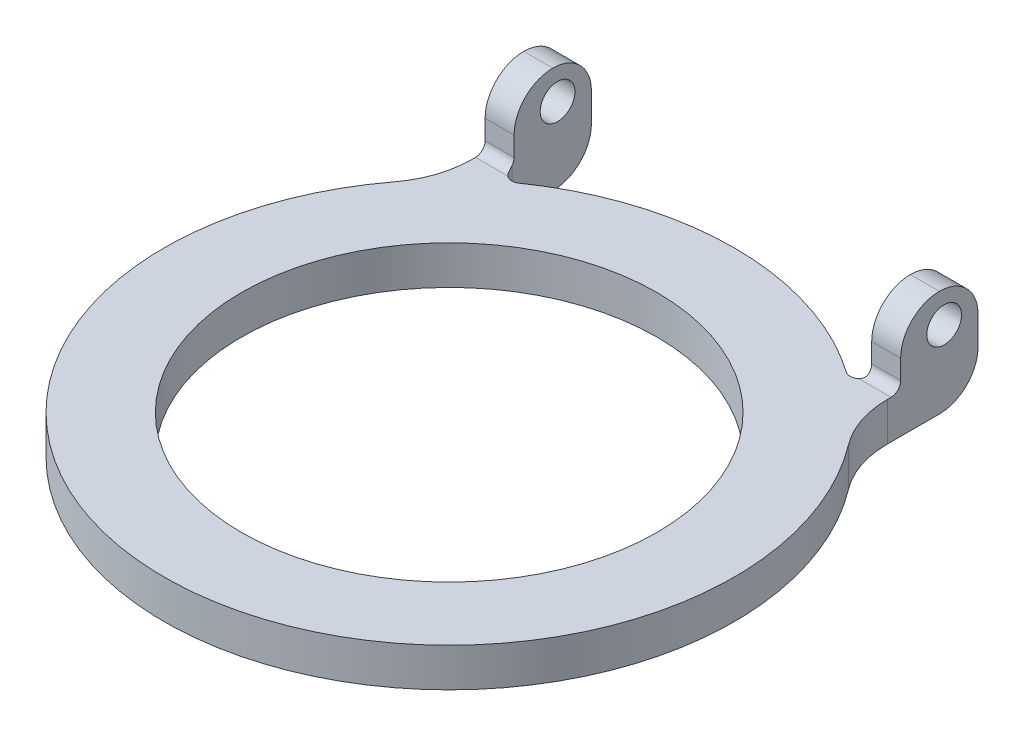
from build123d import *

# Parameters (mm, degrees)
BOSS_EXTRUDE1_DEPTH = 4
SKETCH2_W           = 3
SKETCH2_H           = 8
BOSS_EXTRUDE2_DEPTH = 7
SKETCH3_R           = 1.8
CUT_EXTRUDE1_DEPTH  = 62.847529316
FILLET1_R           = 4
FILLET2_R           = 10
FILLET3_R           = 1
FILLET4_R           = 1
SKETCH4_R           = 21.5
CUT_EXTRUDE2_DEPTH  = 46.764253326


with BuildPart() as part:
    # Sketch1 → Boss-Extrude1 (new body)
    with BuildSketch(Plane(origin=(0, 0, 0), x_dir=(1, 0, 0), z_dir=(0, 1, 0))):
        with BuildLine():
            Line((18.5, 33.213203436), (18.5, 22.978250586))
            ThreePointArc((18.5, 22.978250586), (0, 29.5), (-18.5, 22.978250586))
            Line((-18.5, 22.978250586), (-18.5, 33.213203436))
            Line((-18.5, 33.213203436), (-21.5, 33.213203436))
            Line((-21.5, 33.213203436), (-21.5, 20.199009877))
            ThreePointArc((-21.5, 20.199009877), (0, -29.5), (21.5, 20.199009877))
            Line((21.5, 20.199009877), (21.5, 33.213203436))
            Line((21.5, 33.213203436), (18.5, 33.213203436))
        make_face()
    extrude(amount=BOSS_EXTRUDE1_DEPTH)

    # Sketch2 → Boss-Extrude2 (add)
    with BuildSketch(Plane(origin=(0, 4, 0), x_dir=(1, 0, 0), z_dir=(0, 1, 0))):
        with Locations((-20, 29.213203436)):
            Rectangle(SKETCH2_W, SKETCH2_H)
        with Locations((20, 29.213203436)):
            Rectangle(SKETCH2_W, SKETCH2_H)
    extrude(amount=BOSS_EXTRUDE2_DEPTH)

    # Sketch3 → Cut-Extrude1 (cut, through all)
    with BuildSketch(Plane.ZY.offset(21.5)):
        with Locations(Location((-29.713203436, 7.75, 0), (0, 0, 180))):
            Circle(SKETCH3_R)
    extrude(amount=-CUT_EXTRUDE1_DEPTH, mode=Mode.SUBTRACT)

    # Fillet1
    fillet1_edges = [part.edges().sort_by_distance(p)[0] for p in [
        (-20, 11, -25.213203436),
        (-20, 11, -33.213203436),
        (20, 11, -25.213203436),
        (20, 11, -33.213203436),
        (20, 0, -33.213203436),
        (-20, 0, -33.213203436),
    ]]
    fillet(fillet1_edges, radius=FILLET1_R - 0.0001)  # a hair under: the kernel refuses the full size

    # Fillet2
    fillet2_edges = [part.edges().sort_by_distance(p)[0] for p in [
        (21.5, 2, -20.199009877),
        (-21.5, 2, -20.199009877),
    ]]
    fillet(fillet2_edges, radius=FILLET2_R)

    # Fillet3
    fillet3_edges = [part.edges().sort_by_distance(p)[0] for p in [
        (18.5, 2, -22.978250586),
        (-18.5, 2, -22.978250586),
    ]]
    fillet(fillet3_edges, radius=FILLET3_R)

    # Fillet4
    fillet4_edges = [part.edges().sort_by_distance(p)[0] for p in [
        (-20, 4, -25.213203436),
        (20, 4, -25.213203436),
    ]]
    fillet(fillet4_edges, radius=FILLET4_R)

    # Sketch4 → Cut-Extrude2 (cut, through all)
    with BuildSketch(Plane.XZ):
        with Locations(Location((0, 0, 0), (0, 0, 270))):
            Circle(SKETCH4_R)
    extrude(amount=-CUT_EXTRUDE2_DEPTH, mode=Mode.SUBTRACT)


solid = part.part
